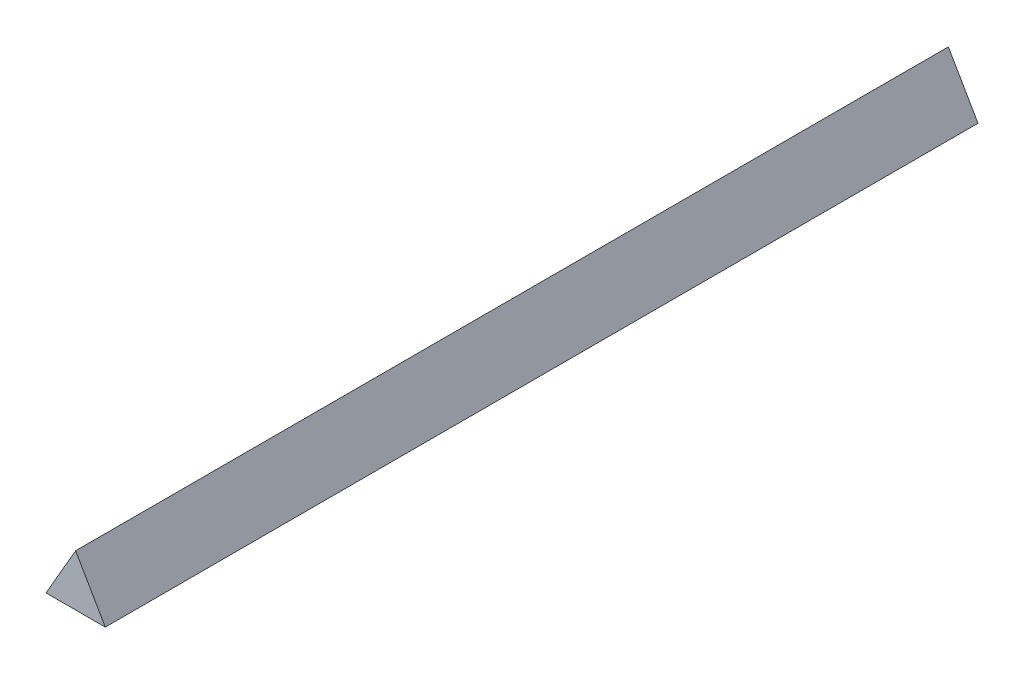
from build123d import *

# Parameters (mm, degrees)
EXTRUDE_1_DEPTH = 34


with BuildPart() as part:
    # Эскиз1 → Бобышка-Вытянуть1 (new body)
    with BuildSketch(Plane.XY):
        Polygon((-1.154700538, -0.666666667), (0, 1.333333333), (1.154700538, -0.666666667), align=None)
    extrude(amount=EXTRUDE_1_DEPTH)


solid = part.part
